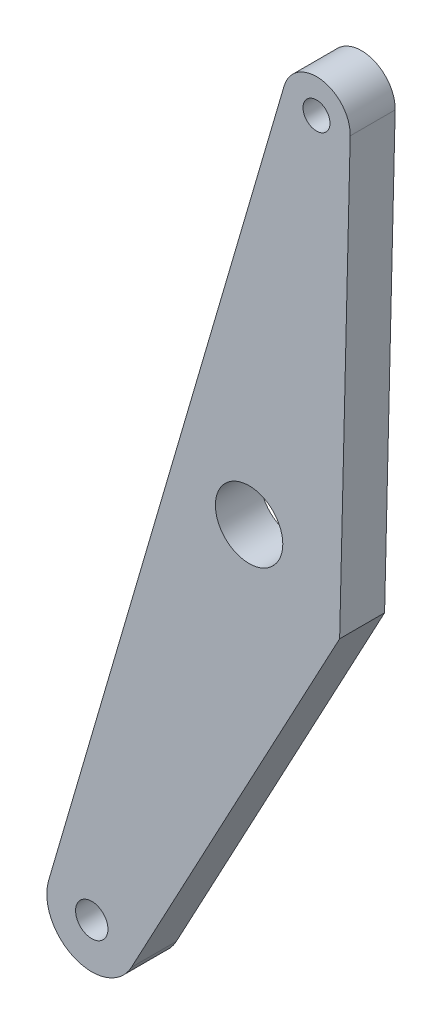
from build123d import *

# Parameters (mm, degrees)
SKETCH1_R           = 2.286
SKETCH1_R_2         = 1.905
SKETCH1_R_3         = 4.7625
BOSS_EXTRUDE1_DEPTH = 6.35


with BuildPart() as part:
    # Sketch1 → Boss-Extrude1 (new body)
    with BuildSketch(Plane.XY):
        with BuildLine():
            Line((-6.095047303, 1.78126314), (27.178714523, 115.635947355))
            ThreePointArc((27.178714523, 115.635947355), (32.481260854, 119.006024204), (36.511130592, 114.185799576))
            Line((36.511130592, 114.185799576), (35.017380191, 51.909842308))
            Line((35.017380191, 51.909842308), (5.597196577, -2.998981573))
            ThreePointArc((5.597196577, -2.998981573), (-2.403049878, -5.877742023), (-6.095047303, 1.78126314))
        make_face()
        Circle(SKETCH1_R, mode=Mode.SUBTRACT)
        with Locations((31.75, 114.3)):
            Circle(SKETCH1_R_2, mode=Mode.SUBTRACT)
        with Locations((22.225, 59.483605935)):
            Circle(SKETCH1_R_3, mode=Mode.SUBTRACT)
    extrude(amount=BOSS_EXTRUDE1_DEPTH)


solid = part.part
